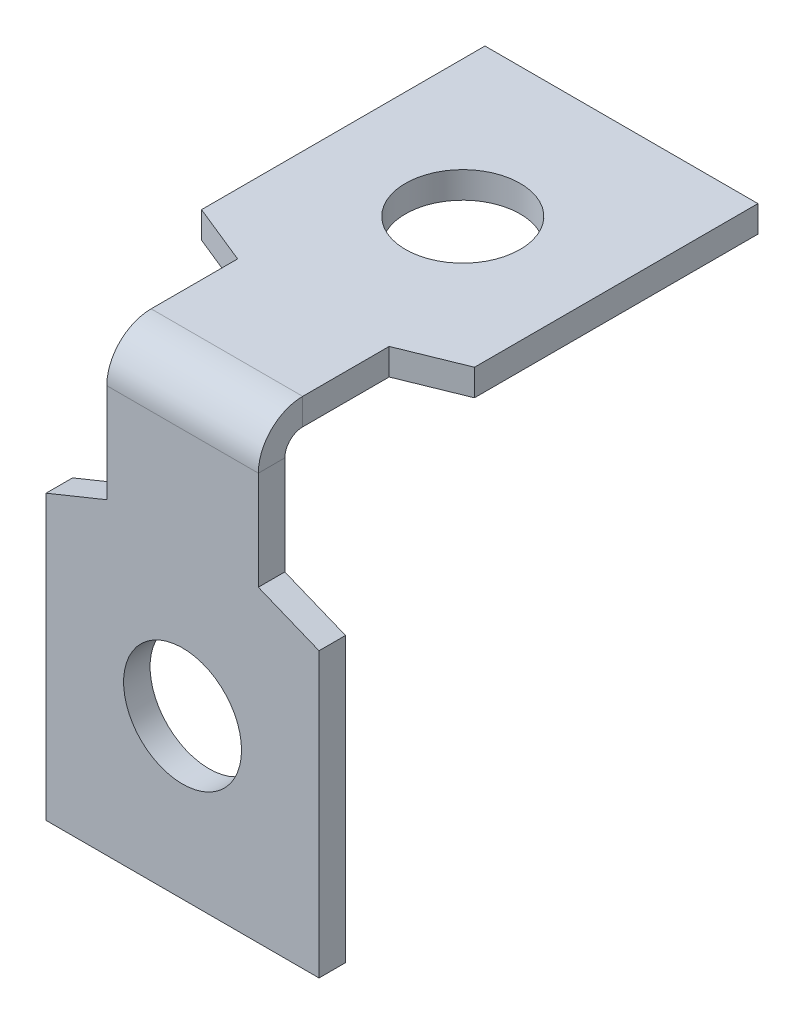
from build123d import *

# Parameters (mm, degrees)
SKETCH1_R                  = 2.430870735
SKETCH1_R_2                = 2.36295848
BASE_FLANGE1_DEPTH         = 1.0922
SKETCHED_START             = 12.060869776
SKETCHED_BEND3_OUTLINE_W   = 11.2522
SKETCHED_BEND3_OUTLINE_H   = 1.0922
SKETCHED_BEND3_DEPTH       = 16.450630224
SKETCHED_START_2           = 10.968669776
SKETCHED_BEND3_2_OUTLINE_R = 2.36295848
SKETCHED_BEND3_2_DEPTH     = 0.899042144
SKETCHED_START_3           = 10.232069776
SKETCHED_BEND3_3_OUTLINE_R = 2.36295848
SKETCHED_BEND3_3_DEPTH     = 1.8288
SKETCHED_START_4           = -5.6261
SKETCHED_BEND3_4_DEPTH     = 11.2522


with BuildPart() as part:
    # Base-Flange1: sheet metal written as solids
    # Sketch1 → Base-Flange1 (new body)
    with BuildSketch(Plane.XY):
        Polygon((-5.6261, 28.5115), (5.6261, 28.5115), (5.6261, 16.8275), (3.1242, 15.8115), (3.1242, 6.1595), (5.6261, 5.1435), (5.6261, -6.5405), (-5.6261, -6.5405), (-5.6261, 5.1435), (-3.1242, 6.1595), (-3.1242, 15.8115), (-5.6261, 16.8275), align=None)
        Circle(SKETCH1_R, mode=Mode.SUBTRACT)
        with Locations((0, 21.971)):
            Circle(SKETCH1_R_2, mode=Mode.SUBTRACT)
    extrude(amount=-BASE_FLANGE1_DEPTH)

    # Sketched Bend3: read off the stored shape, not the designer's step
    # Sketched Bend3 outline → Sketched Bend3 (cut)
    with BuildSketch(Plane(origin=(0, 0, 0), x_dir=(1, 0, 0), z_dir=(0, 1, 0)).offset(SKETCHED_START)):
        with Locations((0, 0.5461)):
            Rectangle(SKETCHED_BEND3_OUTLINE_W, SKETCHED_BEND3_OUTLINE_H)
    extrude(amount=SKETCHED_BEND3_DEPTH, mode=Mode.SUBTRACT)

    # Sketched Bend3 2 outline → Sketched Bend3 2 (add)
    with BuildSketch(Plane(origin=(0, 0, 0), x_dir=(1, 0, 0), z_dir=(0, 1, 0)).offset(SKETCHED_START_2)):
        Polygon((5.6261, 18.093369776), (-5.6261, 18.093369776), (-5.6261, 6.409369776), (-3.1242, 5.393369776), (-3.1242, 1.0922), (3.1242, 1.0922), (3.1242, 5.393369776), (5.6261, 6.409369776), align=None)
        with Locations((0, 11.552869776)):
            Circle(SKETCHED_BEND3_2_OUTLINE_R, mode=Mode.SUBTRACT)
    extrude(amount=SKETCHED_BEND3_2_DEPTH)

    # Sketched Bend3 3 outline → Sketched Bend3 3 (add)
    with BuildSketch(Plane(origin=(0, 0, 0), x_dir=(1, 0, 0), z_dir=(0, 1, 0)).offset(SKETCHED_START_3)):
        Polygon((5.6261, 18.093369776), (-5.6261, 18.093369776), (-5.6261, 6.409369776), (-3.1242, 5.393369776), (-3.1242, 1.0922), (3.1242, 1.0922), (3.1242, 5.393369776), (5.6261, 6.409369776), align=None)
        with Locations((0, 11.552869776)):
            Circle(SKETCHED_BEND3_3_OUTLINE_R, mode=Mode.SUBTRACT)
    extrude(amount=SKETCHED_BEND3_3_DEPTH)

    # Sketched Bend3 4 outline → Sketched Bend3 4 (cut)
    with BuildSketch(Plane.YZ.offset(SKETCHED_START_4)):
        with BuildLine():
            ThreePointArc((10.232069776, 0), (11.525226657, -0.535643119), (12.060869776, -1.8288))
            Line((12.060869776, -1.8288), (12.060869776, 0))
            Line((12.060869776, 0), (10.232069776, 0))
        make_face()
        with BuildLine():
            Line((10.968669776, -18.093369776), (10.968669776, -1.8288))
            ThreePointArc((10.968669776, -1.8288), (10.752924631, -1.307945145), (10.232069776, -1.0922))
            Line((10.232069776, -1.0922), (10.232069776, -18.093369776))
            Line((10.232069776, -18.093369776), (10.968669776, -18.093369776))
        make_face()
    extrude(amount=SKETCHED_BEND3_4_DEPTH, mode=Mode.SUBTRACT)


solid = part.part
